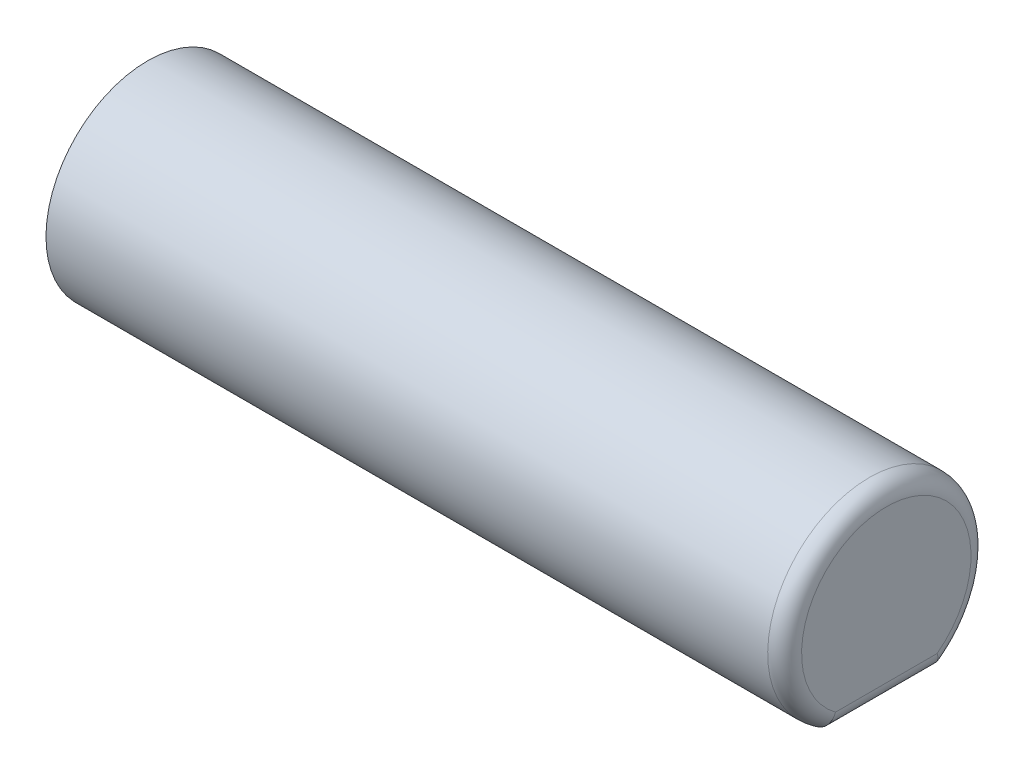
from build123d import *

# Parameters (mm, degrees)
SKETCH1_R           = 3
BOSS_EXTRUDE1_DEPTH = 21.8
CUT_EXTRUDE2_START  = -12
CUT_EXTRUDE2_DEPTH  = 12
FILLET1_R           = 0.5


with BuildPart() as part:
    # Sketch1 → Boss-Extrude1 (new body)
    with BuildSketch(Plane(origin=(0, 0, 0), x_dir=(0, 0, -1), z_dir=(1, 0, 0))):
        Circle(SKETCH1_R)
    extrude(amount=BOSS_EXTRUDE1_DEPTH)

    # Sketch2 → Cut-Extrude2 (cut)
    with BuildSketch(Plane(origin=(21.8, 0, 0), x_dir=(0, 0, -1), z_dir=(1, 0, 0)).offset(CUT_EXTRUDE2_START)):
        with BuildLine():
            Line((0, -2.5), (-1.658312395, -2.5))
            ThreePointArc((-1.658312395, -2.5), (0, -3), (1.658312395, -2.5))
            Line((1.658312395, -2.5), (0, -2.5))
        make_face()
    extrude(amount=CUT_EXTRUDE2_DEPTH, mode=Mode.SUBTRACT)

    # Fillet1
    fillet1_edges = [part.edges().sort_by_distance(p)[0] for p in [
        (21.8, 2.643382037, 1.418637165),
        (21.8, -2.5, 0),
    ]]
    fillet(fillet1_edges, radius=FILLET1_R - 0.0001)  # a hair under: the kernel refuses the full size


solid = part.part
